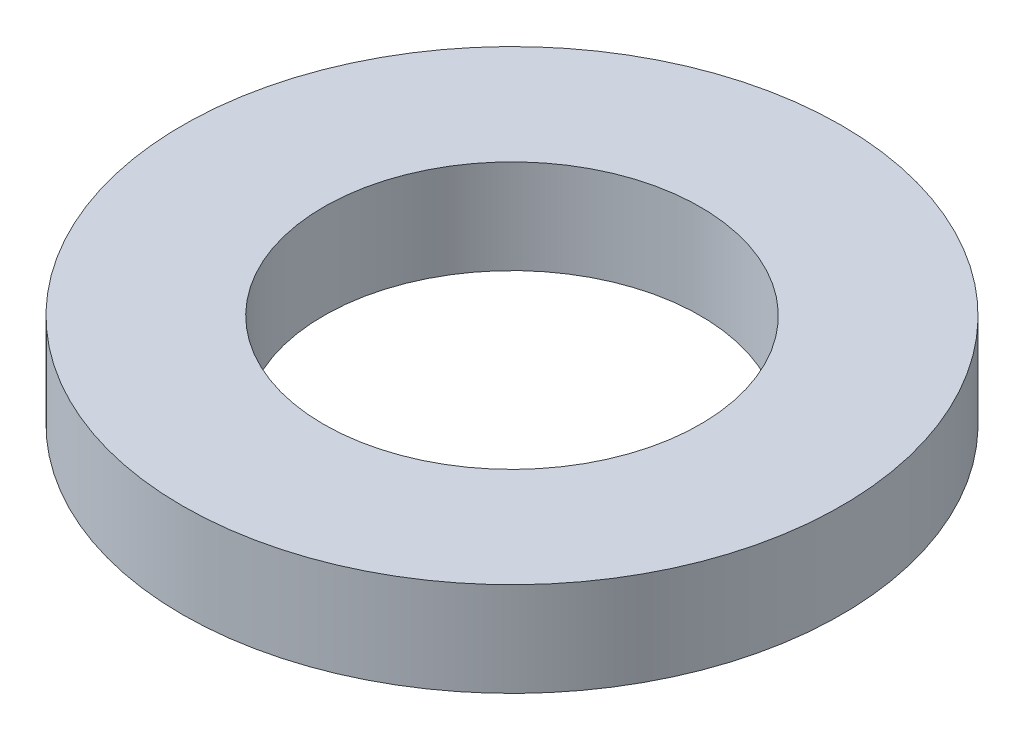
from build123d import *

# Parameters (mm, degrees)
SKETCH1_R           = 52.5
BOSS_EXTRUDE1_DEPTH = 15
SKETCH2_R           = 30
CUT_EXTRUDE1_DEPTH  = 76.746287038


with BuildPart() as part:
    # Sketch1 → Boss-Extrude1 (new body)
    with BuildSketch(Plane(origin=(0, 0, 0), x_dir=(1, 0, 0), z_dir=(0, 1, 0))):
        Circle(SKETCH1_R)
    extrude(amount=BOSS_EXTRUDE1_DEPTH)

    # Sketch2 → Cut-Extrude1 (cut, through all)
    with BuildSketch(Plane(origin=(0, 0, 0), x_dir=(1, 0, 0), z_dir=(0, 1, 0))):
        Circle(SKETCH2_R)
    extrude(amount=CUT_EXTRUDE1_DEPTH, mode=Mode.SUBTRACT)


solid = part.part
